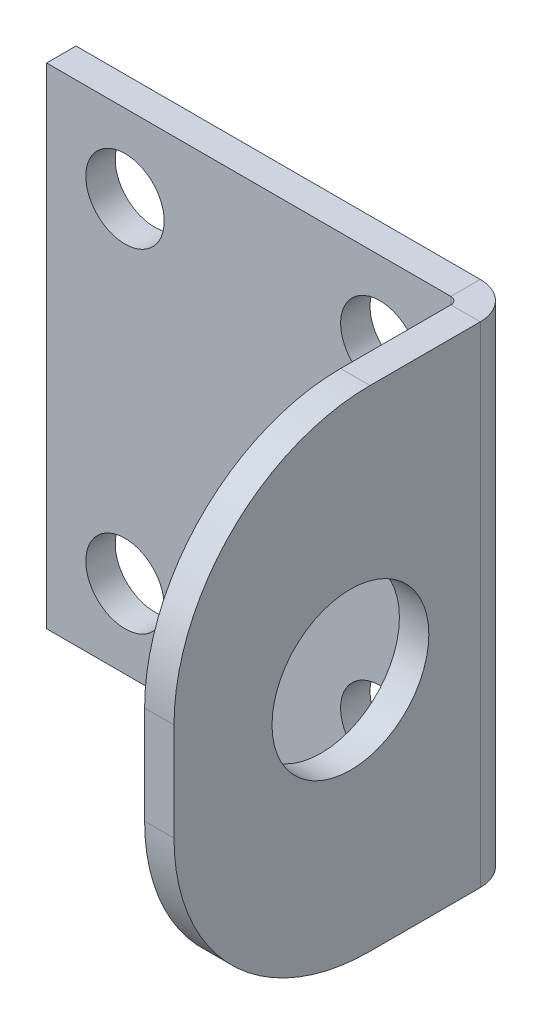
from build123d import *

# Parameters (mm, degrees)
SM_BASE_FLANGE_1_DEPTH = 25
FILLET_1_R             = 20
SKETCH_8_R             = 8
CUT_EXTRUDE_1_DEPTH    = 63.24949799
SKETCH_9_R             = 4
CUT_EXTRUDE_2_DEPTH    = 61.613529843


# Sheet-metal steps are written as plain solids
with BuildPart() as part:
    # Sketch 1 → Базовая кромка1 (new body)
    with BuildSketch(Plane(origin=(0, 0, 0), x_dir=(1, 0, 0), z_dir=(0, 1, 0))):
        with BuildLine():
            Line((-45, 0), (-3.75, 0))
            ThreePointArc((-3.75, 0), (-1.098349571, -1.098349571), (0, -3.75))
            Line((0, -3.75), (0, -35))
            Line((0, -35), (-3, -35))
            Line((-3, -35), (-3, -3.75))
            ThreePointArc((-3, -3.75), (-3.219669914, -3.219669914), (-3.75, -3))
            Line((-3.75, -3), (-45, -3))
            Line((-45, -3), (-45, 0))
        make_face()
    extrude(amount=SM_BASE_FLANGE_1_DEPTH)

    # Скругление1
    fillet_1_edges = [part.edges().sort_by_distance(p)[0] for p in [
        (-1.5, 25, 35),
    ]]
    fillet(fillet_1_edges, radius=FILLET_1_R)

    # Зеркальное отражение1: part across plane


with BuildPart() as part_1:
    add(part.part)
    add(part.part.mirror(Plane(origin=(-3.75, 0, 3.75), x_dir=(0, 0, 1), z_dir=(0, 1, 0))))

    # Эскиз8 → Вырез-Вытянуть1 (cut, through all)
    with BuildSketch(Plane(origin=(0, 0, 0), x_dir=(0, 0, -1), z_dir=(1, 0, 0))):
        with Locations((-17, 0)):
            Circle(SKETCH_8_R)
    extrude(amount=-CUT_EXTRUDE_1_DEPTH, mode=Mode.SUBTRACT)

    # Эскиз9 → Вырез-Вытянуть2 (cut, through all)
    with BuildSketch(Plane.XY.offset(3)):
        with Locations((-37, 17)):
            Circle(SKETCH_9_R)
        with Locations((-11, 17)):
            Circle(SKETCH_9_R)
        with Locations((-11, -17)):
            Circle(SKETCH_9_R)
        with Locations((-37, -17)):
            Circle(SKETCH_9_R)
    extrude(amount=-CUT_EXTRUDE_2_DEPTH, mode=Mode.SUBTRACT)


solid = part_1.part
